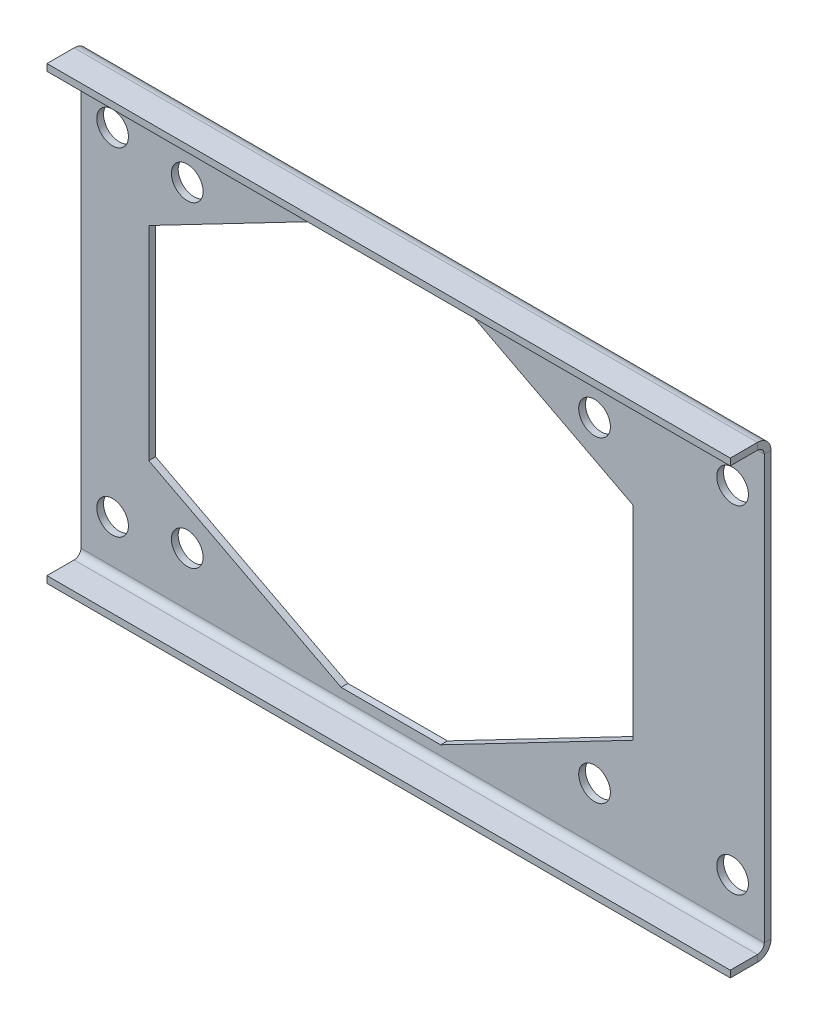
from build123d import *

# Parameters (mm, degrees)
SM_BASE_FLANGE_1_DEPTH           = 3
SM_EDGE_FLANGE_1_STRIP_W         = 18
SM_EDGE_FLANGE_1_STRIP_H         = 3
SM_EDGE_FLANGE_1_STRIP_CUT_DEPTH = 302
SM_EDGE_FLANGE_1_DEPTH           = 302
SKETCH_9_R                       = 7
CUT_EXTRUDE_1_DEPTH              = 10
SKETCH_10_R                      = 7
CUT_EXTRUDE_2_DEPTH              = 3


# Sheet-metal steps are written as plain solids
with BuildPart() as part:
    # Sketch 1 → Базовая кромка1 (new body)
    with BuildSketch(Plane.XY):
        Polygon((-151, 0), (151, 0), (151, 96.5), (93, 96.5), (93, 51.5), (8, 7.25), (-36, 7.25), (-121, 51.5), (-121, 96.5), (-151, 96.5), align=None)
    extrude(amount=-SM_BASE_FLANGE_1_DEPTH)

    # Ребро-кромка1 strip (across the edge) → Ребро-кромка1 strip cut (cut)
    with BuildSketch(Plane.YZ.offset(-151)):
        with Locations((-6, -1.5)):
            Rectangle(SM_EDGE_FLANGE_1_STRIP_W, SM_EDGE_FLANGE_1_STRIP_H)
    extrude(amount=SM_EDGE_FLANGE_1_STRIP_CUT_DEPTH, mode=Mode.SUBTRACT)

    # Ребро-кромка1 section (across the edge) → Ребро-кромка1 (add)
    with BuildSketch(Plane.YZ.offset(-151)):
        with BuildLine():
            Line((-3, 3), (-3, 15))
            Line((-3, 15), (0, 15))
            Line((0, 15), (0, 3))
            ThreePointArc((0, 3), (0.878679656, 0.878679656), (3, 0))
            Line((3, 0), (3, -3))
            ThreePointArc((3, -3), (-1.242640687, -1.242640687), (-3, 3))
        make_face()
    extrude(amount=SM_EDGE_FLANGE_1_DEPTH)

    # Зеркальное отражение1: part across plane


with BuildPart() as part_1:
    add(part.part)
    add(part.part.mirror(Plane(origin=(-151, 96.5, -3), x_dir=(0, 0, 1), z_dir=(0, 1, 0))))

    # Эскиз9 → Вырез-Вытянуть1 (cut)
    with BuildSketch(Plane(origin=(0, 0, -3), x_dir=(-1, 0, 0), z_dir=(0, 0, -1))):
        with Locations((137, 171)):
            Circle(SKETCH_9_R)
        with Locations((137, 22)):
            Circle(SKETCH_9_R)
        with Locations(Location((-137, 22, 0), (0, 0, 180))):
            Circle(SKETCH_9_R)
        with Locations(Location((-137, 171, 0), (0, 0, 180))):
            Circle(SKETCH_9_R)
    extrude(amount=-CUT_EXTRUDE_1_DEPTH, mode=Mode.SUBTRACT)

    # Эскиз10 → Вырез-Вытянуть2 (cut)
    with BuildSketch(Plane.XY):
        with Locations((76, 166.5)):
            Circle(SKETCH_10_R)
        with Locations((-104, 166.5)):
            Circle(SKETCH_10_R)
        with Locations((-104, 26.5)):
            Circle(SKETCH_10_R)
        with Locations((76, 26.5)):
            Circle(SKETCH_10_R)
    extrude(amount=-CUT_EXTRUDE_2_DEPTH, mode=Mode.SUBTRACT)


solid = part_1.part
